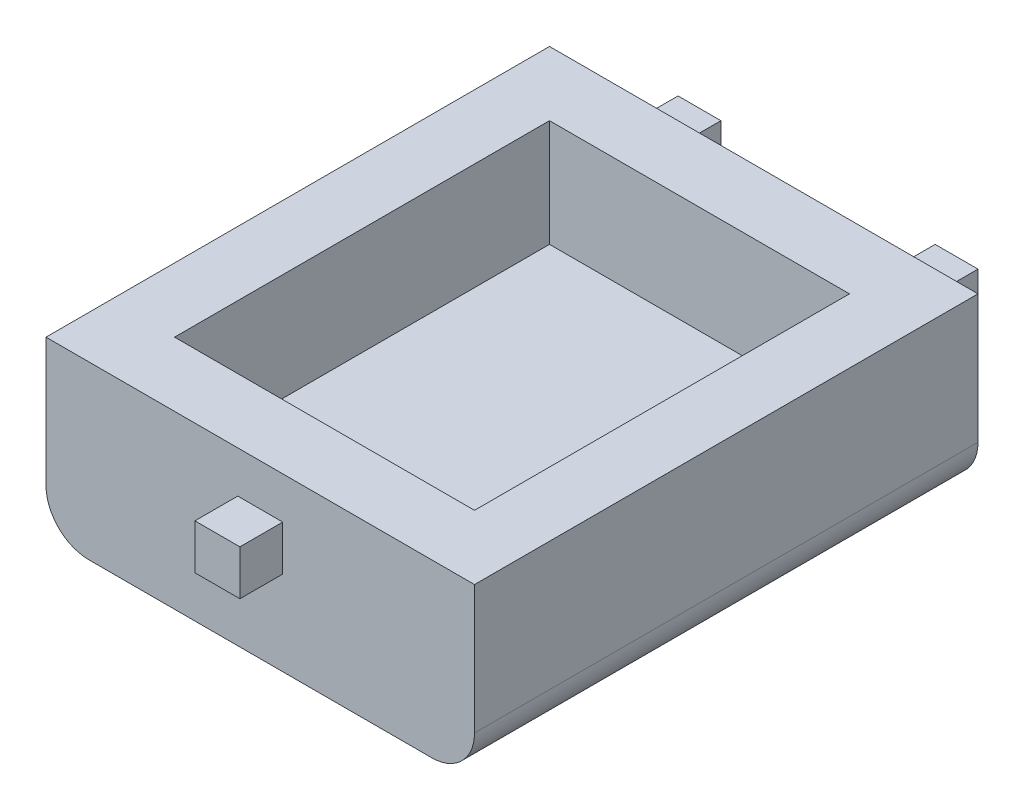
from build123d import *

# Parameters (mm, degrees)
SKETCH1_W                = 2.1
SKETCH1_H                = 2.1
BOSS_EXTRUDE1_DEPTH      = 2
SKETCH4_W                = 2.2
SKETCH4_H                = 2.2
BOSS_EXTRUDE3_DEPTH      = 2
SWEEP4_START             = -1.1
SWEEP4_DEPTH             = 2.2
SKETCH8_W                = 2.2
SKETCH8_H                = 2.2
SKETCH8_W_2              = 2
SKETCH8_H_2              = 2
CUT_EXTRUDE2_DEPTH       = 5
SKETCH9_W                = 2
SKETCH9_H                = 2
CUT_EXTRUDE3_DEPTH       = 2
BOSS_EXTRUDE4_DEPTH      = 3
BOSS_EXTRUDE4_DEPTH_BACK = 5
SKETCH10_W               = 20
SKETCH10_H               = 23.5
SKETCH11_W               = 14
SKETCH11_H               = 17.5
CUT_EXTRUDE4_DEPTH       = 5
FILLET1_R                = 2


# Read off the part's stored shape, not the designer's step: Sweep4
with BuildPart() as part:
    # Sketch1 → Boss-Extrude1 (new body)
    with BuildSketch(Plane.XY):
        Rectangle(SKETCH1_W, SKETCH1_H)
    extrude(amount=BOSS_EXTRUDE1_DEPTH)

    # Sketch4 → Boss-Extrude3 (add)
    with BuildSketch(Plane.XY):
        Rectangle(SKETCH4_W, SKETCH4_H)
    extrude(amount=-BOSS_EXTRUDE3_DEPTH)

    # Sweep4 outline → Sweep4 (add)
    with BuildSketch(Plane(origin=(0, 0, 0), x_dir=(1, 0, 0), z_dir=(0, 1, 0)).offset(SWEEP4_START)):
        with BuildLine():
            Line((7.09999865, 11.165148445), (7.09999919, 28.5))
            Line((7.09999919, 28.5), (4.89999919, 28.5))
            Line((4.89999919, 28.5), (4.89999865, 11.165148445))
            ThreePointArc((4.89999865, 11.165148445), (4.099633159, 8.481308894), (1.959999989, 6.674225732))
            ThreePointArc((1.959999989, 6.674225732), (-0.2669663, 4.793384792), (-1.1, 2))
            Line((-1.1, 2), (1.1, 2))
            ThreePointArc((1.1, 2), (1.573685829, 3.588395274), (2.839999687, 4.657893766))
            ThreePointArc((2.839999687, 4.657893766), (5.940285288, 7.276319376), (7.09999865, 11.165148445))
        make_face()
    sweep4 = extrude(amount=SWEEP4_DEPTH)

    # Mirror1: Sweep4 across plane
    add(sweep4.mirror(Plane(origin=(0, 0, 0), x_dir=(0, 0, 1), z_dir=(1, 0, 0))))

    # Sketch8 → Cut-Extrude2 (cut)
    with BuildSketch(Plane(origin=(0, 0, -28.5), x_dir=(-1, 0, 0), z_dir=(0, 0, -1))):
        with Locations((-5.99999919, 0)):
            Rectangle(SKETCH8_W, SKETCH8_H)
        with Locations((-5.99999919, 0)):
            Rectangle(SKETCH8_W_2, SKETCH8_H_2, mode=Mode.SUBTRACT)
    cut_extrude2 = extrude(amount=-CUT_EXTRUDE2_DEPTH, mode=Mode.SUBTRACT)

    # Sketch9 → Cut-Extrude3 (cut)
    with BuildSketch(Plane(origin=(0, 0, -28.5), x_dir=(-1, 0, 0), z_dir=(0, 0, -1))):
        with Locations((-5.99999919, 0)):
            Rectangle(SKETCH9_W, SKETCH9_H)
    cut_extrude3 = extrude(amount=-CUT_EXTRUDE3_DEPTH, mode=Mode.SUBTRACT)

    # Mirror2: Cut-Extrude2, Cut-Extrude3 across plane
    add(cut_extrude2.mirror(Plane(origin=(0, 0, 0), x_dir=(0, 0, 1), z_dir=(1, 0, 0))), mode=Mode.SUBTRACT)
    add(cut_extrude3.mirror(Plane(origin=(0, 0, 0), x_dir=(0, 0, 1), z_dir=(1, 0, 0))), mode=Mode.SUBTRACT)

    # Sketch10 → Boss-Extrude4 (add, two sides: drawn at the far end of the back side and taken through both)
    with BuildSketch(Plane(origin=(0, 0, 0), x_dir=(1, 0, 0), z_dir=(0, 1, 0)).offset(-BOSS_EXTRUDE4_DEPTH_BACK)):
        with Locations((0, 11.75)):
            Rectangle(SKETCH10_W, SKETCH10_H)
    extrude(amount=BOSS_EXTRUDE4_DEPTH + BOSS_EXTRUDE4_DEPTH_BACK)

    # Sketch11 → Cut-Extrude4 (cut)
    with BuildSketch(Plane(origin=(0, 3, 0), x_dir=(1, 0, 0), z_dir=(0, 1, 0))):
        with Locations((0, 11.75)):
            Rectangle(SKETCH11_W, SKETCH11_H)
    extrude(amount=-CUT_EXTRUDE4_DEPTH, mode=Mode.SUBTRACT)

    # Fillet1
    fillet1_edges = [part.edges().sort_by_distance(p)[0] for p in [
        (-10, -5, -11.75),
        (10, -5, -11.75),
    ]]
    fillet(fillet1_edges, radius=FILLET1_R)


solid = part.part
